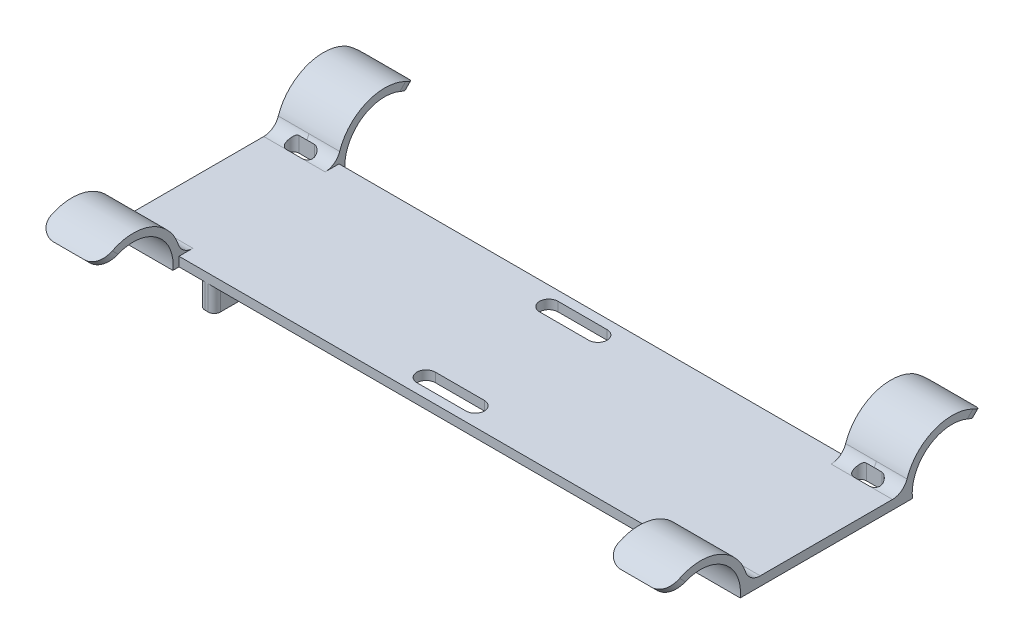
from build123d import *

# Parameters (mm, degrees)
BOSS_EXTRUDE2_DEPTH = 102.5
SKETCH5_W           = 165
SKETCH5_H           = 103.920310216
CUT_EXTRUDE1_DEPTH  = 116.767472629
CUT_EXTRUDE2_REACH  = 117.767
FILLET1_START       = -90.0000001
FILLET1_DEPTH       = 7.5000001
FILLET1_START_2     = 94.9999999
FILLET1_2_DEPTH     = 7.5000001
FILLET1_START_3     = -102.5
FILLET1_3_DEPTH     = 7.5
FILLET1_START_4     = 82.5
FILLET1_4_DEPTH     = 7.5
FILLET1_START_5     = -95.601637974
FILLET1_5_DEPTH     = 6.203275948
FILLET1_START_6     = 89.398362026
FILLET1_6_DEPTH     = 6.203275948
FILLET1_START_7     = 1.5
FILLET1_7_DEPTH     = 2.821223736
FILLET1_8_DEPTH     = 20
FILLET1_9_DEPTH     = 20
FILLET2_R           = 5
CUT_EXTRUDE3_REACH  = 117.767
SKETCH6_W           = 165
SKETCH6_H           = 2
SKETCH7_W           = 5
SKETCH7_H           = 52.17365686
BOSS_EXTRUDE3_DEPTH = 8
FILLET3_R           = 2


with BuildPart() as part:
    # Sketch2 → Boss-Extrude2 (new, symmetric)
    with BuildSketch(Plane(origin=(0, 0, 0), x_dir=(0, 0, -1), z_dir=(1, 0, 0))):
        with BuildLine():
            Line((-51.960155108, 10.960155108), (-50.192388155, 9.192388155))
            ThreePointArc((-50.192388155, 9.192388155), (-36.727498837, 12.277855424), (-28.08682843, 1.5))
            Line((-28.08682843, 1.5), (-25.572751379, 1.5))
            ThreePointArc((-25.572751379, 1.5), (-35.769095224, 14.590669458), (-51.960155108, 10.960155108))
        make_face()
        with BuildLine():
            Line((-25.572751379, 1.5), (-28.08682843, 1.5))
            ThreePointArc((-28.08682843, 1.5), (-28.021725261, 0.751255479), (-28, 0))
            ThreePointArc((-28, 0), (-28.021725261, -0.751255479), (-28.08682843, -1.5))
            Line((-28.08682843, -1.5), (-25.572751379, -1.5))
            ThreePointArc((-25.572751379, -1.5), (-25.518198528, -0.750881609), (-25.5, 0))
            ThreePointArc((-25.5, 0), (-25.518198528, 0.750881609), (-25.572751379, 1.5))
        make_face()
        with BuildLine():
            Line((25.572751379, 1.5), (-25.572751379, 1.5))
            ThreePointArc((-25.572751379, 1.5), (-25.518198528, 0.750881609), (-25.5, 0))
            ThreePointArc((-25.5, 0), (-25.518198528, -0.750881609), (-25.572751379, -1.5))
            Line((-25.572751379, -1.5), (25.572751379, -1.5))
            ThreePointArc((25.572751379, -1.5), (25.5, 0), (25.572751379, 1.5))
        make_face()
        with BuildLine():
            Line((28.08682843, 1.5), (25.572751379, 1.5))
            ThreePointArc((25.572751379, 1.5), (25.5, 0), (25.572751379, -1.5))
            Line((25.572751379, -1.5), (28.08682843, -1.5))
            ThreePointArc((28.08682843, -1.5), (28, 0), (28.08682843, 1.5))
        make_face()
        with BuildLine():
            ThreePointArc((51.960155108, 10.960155108), (35.769095224, 14.590669458), (25.572751379, 1.5))
            Line((25.572751379, 1.5), (28.08682843, 1.5))
            ThreePointArc((28.08682843, 1.5), (36.727498837, 12.277855424), (50.192388155, 9.192388155))
            Line((50.192388155, 9.192388155), (51.960155108, 10.960155108))
        make_face()
    extrude(amount=BOSS_EXTRUDE2_DEPTH, both=True)

    # Sketch5 → Cut-Extrude1 (cut, through all)
    # profile 1 of 5: a face of its own
    with BuildSketch(Plane(origin=(0, 1.5, 0), x_dir=(1, 0, 0), z_dir=(0, 1, 0))):
        Rectangle(SKETCH5_W, SKETCH5_H)
        with BuildLine():
            Line((-8, 23), (8, 23))
            ThreePointArc((8, 23), (11, 20), (8, 17))
            Line((8, 17), (-8, 17))
            ThreePointArc((-8, 17), (-11, 20), (-8, 23))
        make_face(mode=Mode.SUBTRACT)
        with BuildLine():
            Line((-8, -23), (8, -23))
            ThreePointArc((8, -23), (11, -20), (8, -17))
            Line((8, -17), (-8, -17))
            ThreePointArc((-8, -17), (-11, -20), (-8, -23))
        make_face(mode=Mode.SUBTRACT)
    # profile 2 of 5: a face of its own
    with BuildSketch(Plane(origin=(0, 1.5, 0), x_dir=(1, 0, 0), z_dir=(0, 1, 0))):
        with BuildLine():
            Line((-95, 25.572751379), (-90, 25.572751379))
            ThreePointArc((-90, 25.572751379), (-88, 23.572751379), (-90, 21.572751379))
            Line((-90, 21.572751379), (-95, 21.572751379))
            ThreePointArc((-95, 21.572751379), (-97, 23.572751379), (-95, 25.572751379))
        make_face()
    # profile 3 of 5: a face of its own
    with BuildSketch(Plane(origin=(0, 1.5, 0), x_dir=(1, 0, 0), z_dir=(0, 1, 0))):
        with BuildLine():
            Line((-95, -25.572751379), (-90, -25.572751379))
            ThreePointArc((-90, -25.572751379), (-88, -23.572751379), (-90, -21.572751379))
            Line((-90, -21.572751379), (-95, -21.572751379))
            ThreePointArc((-95, -21.572751379), (-97, -23.572751379), (-95, -25.572751379))
        make_face()
    # profile 4 of 5: a face of its own
    with BuildSketch(Plane(origin=(0, 1.5, 0), x_dir=(1, 0, 0), z_dir=(0, 1, 0))):
        with BuildLine():
            Line((95, 25.572751379), (90, 25.572751379))
            ThreePointArc((90, 25.572751379), (88, 23.572751379), (90, 21.572751379))
            Line((90, 21.572751379), (95, 21.572751379))
            ThreePointArc((95, 21.572751379), (97, 23.572751379), (95, 25.572751379))
        make_face()
    # profile 5 of 5: a face of its own
    with BuildSketch(Plane(origin=(0, 1.5, 0), x_dir=(1, 0, 0), z_dir=(0, 1, 0))):
        with BuildLine():
            Line((95, -25.572751379), (90, -25.572751379))
            ThreePointArc((90, -25.572751379), (88, -23.572751379), (90, -21.572751379))
            Line((90, -21.572751379), (95, -21.572751379))
            ThreePointArc((95, -21.572751379), (97, -23.572751379), (95, -25.572751379))
        make_face()
    extrude(amount=CUT_EXTRUDE1_DEPTH, mode=Mode.SUBTRACT)

    # Sketch5<3> → Cut-Extrude2 (cut, up to next)
    with BuildSketch(Plane(origin=(0, 1.5, 0), x_dir=(1, 0, 0), z_dir=(0, 1, 0)), mode=Mode.PRIVATE) as cut_extrude2_sk1:
        with BuildLine():
            Line((-95, 25.572751379), (-90, 25.572751379))
            ThreePointArc((-90, 25.572751379), (-88, 23.572751379), (-90, 21.572751379))
            Line((-90, 21.572751379), (-95, 21.572751379))
            ThreePointArc((-95, 21.572751379), (-97, 23.572751379), (-95, 25.572751379))
        make_face()
    cut_extrude2_tool1 = extrude(cut_extrude2_sk1.sketch, amount=-CUT_EXTRUDE2_REACH, mode=Mode.PRIVATE) & part.part
    # Sketch5<3> → Cut-Extrude2 (cut, up to next)
    with BuildSketch(Plane(origin=(0, 1.5, 0), x_dir=(1, 0, 0), z_dir=(0, 1, 0)), mode=Mode.PRIVATE) as cut_extrude2_sk2:
        with BuildLine():
            Line((-95, -25.572751379), (-90, -25.572751379))
            ThreePointArc((-90, -25.572751379), (-88, -23.572751379), (-90, -21.572751379))
            Line((-90, -21.572751379), (-95, -21.572751379))
            ThreePointArc((-95, -21.572751379), (-97, -23.572751379), (-95, -25.572751379))
        make_face()
    cut_extrude2_tool2 = extrude(cut_extrude2_sk2.sketch, amount=-CUT_EXTRUDE2_REACH, mode=Mode.PRIVATE) & part.part
    # Sketch5<3> → Cut-Extrude2 (cut, up to next)
    with BuildSketch(Plane(origin=(0, 1.5, 0), x_dir=(1, 0, 0), z_dir=(0, 1, 0)), mode=Mode.PRIVATE) as cut_extrude2_sk3:
        with BuildLine():
            Line((95, 25.572751379), (90, 25.572751379))
            ThreePointArc((90, 25.572751379), (88, 23.572751379), (90, 21.572751379))
            Line((90, 21.572751379), (95, 21.572751379))
            ThreePointArc((95, 21.572751379), (97, 23.572751379), (95, 25.572751379))
        make_face()
    cut_extrude2_tool3 = extrude(cut_extrude2_sk3.sketch, amount=-CUT_EXTRUDE2_REACH, mode=Mode.PRIVATE) & part.part
    # Sketch5<3> → Cut-Extrude2 (cut, up to next)
    with BuildSketch(Plane(origin=(0, 1.5, 0), x_dir=(1, 0, 0), z_dir=(0, 1, 0)), mode=Mode.PRIVATE) as cut_extrude2_sk4:
        with BuildLine():
            Line((95, -25.572751379), (90, -25.572751379))
            ThreePointArc((90, -25.572751379), (88, -23.572751379), (90, -21.572751379))
            Line((90, -21.572751379), (95, -21.572751379))
            ThreePointArc((95, -21.572751379), (97, -23.572751379), (95, -25.572751379))
        make_face()
    cut_extrude2_tool4 = extrude(cut_extrude2_sk4.sketch, amount=-CUT_EXTRUDE2_REACH, mode=Mode.PRIVATE) & part.part
    # Sketch5<3> → Cut-Extrude2 (cut, up to next)
    with BuildSketch(Plane(origin=(0, 1.5, 0), x_dir=(1, 0, 0), z_dir=(0, 1, 0)), mode=Mode.PRIVATE) as cut_extrude2_sk5:
        with BuildLine():
            Line((-8, 23), (8, 23))
            ThreePointArc((8, 23), (11, 20), (8, 17))
            Line((8, 17), (-8, 17))
            ThreePointArc((-8, 17), (-11, 20), (-8, 23))
        make_face()
    cut_extrude2_tool5 = extrude(cut_extrude2_sk5.sketch, amount=-CUT_EXTRUDE2_REACH, mode=Mode.PRIVATE) & part.part
    # Sketch5<3> → Cut-Extrude2 (cut, up to next)
    with BuildSketch(Plane(origin=(0, 1.5, 0), x_dir=(1, 0, 0), z_dir=(0, 1, 0)), mode=Mode.PRIVATE) as cut_extrude2_sk6:
        with BuildLine():
            Line((-8, -23), (8, -23))
            ThreePointArc((8, -23), (11, -20), (8, -17))
            Line((8, -17), (-8, -17))
            ThreePointArc((-8, -17), (-11, -20), (-8, -23))
        make_face()
    cut_extrude2_tool6 = extrude(cut_extrude2_sk6.sketch, amount=-CUT_EXTRUDE2_REACH, mode=Mode.PRIVATE) & part.part
    add(cut_extrude2_tool1.solids().sort_by_distance((-92.5, 1.5, -23.572751))[0], mode=Mode.SUBTRACT)
    add(cut_extrude2_tool2.solids().sort_by_distance((-92.5, 1.5, 23.572751))[0], mode=Mode.SUBTRACT)
    add(cut_extrude2_tool3.solids().sort_by_distance((92.5, 1.5, -23.572751))[0], mode=Mode.SUBTRACT)
    add(cut_extrude2_tool4.solids().sort_by_distance((92.5, 1.5, 23.572751))[0], mode=Mode.SUBTRACT)
    add(cut_extrude2_tool5.solids().sort_by_distance((0, 1.5, -20))[0], mode=Mode.SUBTRACT)
    add(cut_extrude2_tool6.solids().sort_by_distance((0, 1.5, 20))[0], mode=Mode.SUBTRACT)

    # Fillet1: read off the stored shape, not the designer's step
    # Fillet1 outline → Fillet1 (add)
    with BuildSketch(Plane.YZ.offset(FILLET1_START)):
        with BuildLine():
            Line((1.5, 25.572751379), (1.5, 21.557777905))
            ThreePointArc((1.5, 21.557777905), (2.442486644, 24.479521454), (4.914634146, 26.299783294))
            ThreePointArc((4.914634146, 26.299783294), (3.22785171, 25.83982278), (1.5, 25.572751379))
        make_face()
        with BuildLine():
            ThreePointArc((3.520069129, -25.57275138), (2.033477059, -23.805036862), (1.5, -21.557777905))
            Line((1.5, -21.557777905), (1.5, -25.572751379))
            Line((1.5, -25.572751379), (3.520069129, -25.57275138))
        make_face()
    extrude(amount=FILLET1_DEPTH)

    # Fillet1 2 outline → Fillet1 2 (add)
    with BuildSketch(Plane.YZ.offset(FILLET1_START_2)):
        with BuildLine():
            Line((1.5, 25.572751379), (1.5, 21.557777905))
            ThreePointArc((1.5, 21.557777905), (2.442486644, 24.479521454), (4.914634146, 26.299783294))
            ThreePointArc((4.914634146, 26.299783294), (3.22785171, 25.83982278), (1.5, 25.572751379))
        make_face()
        with BuildLine():
            ThreePointArc((3.520069129, -25.57275138), (2.033477059, -23.805036862), (1.5, -21.557777905))
            Line((1.5, -21.557777905), (1.5, -25.572751379))
            Line((1.5, -25.572751379), (3.520069129, -25.57275138))
        make_face()
    extrude(amount=FILLET1_2_DEPTH)

    # Fillet1 3 outline → Fillet1 3 (add)
    with BuildSketch(Plane.YZ.offset(FILLET1_START_3)):
        with BuildLine():
            Line((1.5, 25.572751379), (1.5, 21.557777905))
            ThreePointArc((1.5, 21.557777905), (2.442486644, 24.479521454), (4.914634146, 26.299783294))
            ThreePointArc((4.914634146, 26.299783294), (3.22785171, 25.83982278), (1.5, 25.572751379))
        make_face()
        with BuildLine():
            ThreePointArc((3.520069129, -25.57275138), (2.033477059, -23.805036862), (1.5, -21.557777905))
            Line((1.5, -21.557777905), (1.5, -25.572751379))
            Line((1.5, -25.572751379), (3.520069129, -25.57275138))
        make_face()
    extrude(amount=FILLET1_3_DEPTH)

    # Fillet1 4 outline → Fillet1 4 (add)
    with BuildSketch(Plane.YZ.offset(FILLET1_START_4)):
        with BuildLine():
            Line((1.5, 25.572751379), (1.5, 21.557777905))
            ThreePointArc((1.5, 21.557777905), (2.442486644, 24.479521454), (4.914634146, 26.299783294))
            ThreePointArc((4.914634146, 26.299783294), (3.22785171, 25.83982278), (1.5, 25.572751379))
        make_face()
        with BuildLine():
            ThreePointArc((3.520069129, -25.57275138), (2.033477059, -23.805036862), (1.5, -21.557777905))
            Line((1.5, -21.557777905), (1.5, -25.572751379))
            Line((1.5, -25.572751379), (3.520069129, -25.57275138))
        make_face()
    extrude(amount=FILLET1_4_DEPTH)

    # Fillet1 5 outline → Fillet1 5 (add)
    with BuildSketch(Plane.YZ.offset(FILLET1_START_5)):
        with BuildLine():
            Line((1.5, 25.572751379), (3.520069129, 25.57275138))
            ThreePointArc((3.520069129, 25.57275138), (4.188587575, 25.991441469), (4.914634146, 26.299783294))
            ThreePointArc((4.914634146, 26.299783294), (3.22785171, 25.83982278), (1.5, 25.572751379))
        make_face()
    extrude(amount=FILLET1_5_DEPTH)

    # Fillet1 6 outline → Fillet1 6 (add)
    with BuildSketch(Plane.YZ.offset(FILLET1_START_6)):
        with BuildLine():
            Line((1.5, 25.572751379), (3.520069129, 25.57275138))
            ThreePointArc((3.520069129, 25.57275138), (4.188587575, 25.991441469), (4.914634146, 26.299783294))
            ThreePointArc((4.914634146, 26.299783294), (3.22785171, 25.83982278), (1.5, 25.572751379))
        make_face()
    extrude(amount=FILLET1_6_DEPTH)

    # Fillet1 7 outline → Fillet1 7 (cut)
    with BuildSketch(Plane(origin=(0, 0, 0), x_dir=(1, 0, 0), z_dir=(0, 1, 0)).offset(FILLET1_START_7)):
        with BuildLine():
            Line((95, -21.572751379), (95, -25.572751379))
            ThreePointArc((95, -25.572751379), (97, -23.572751379), (95, -21.572751379))
        make_face()
        with BuildLine():
            Line((90, -25.572751379), (90, -21.572751379))
            ThreePointArc((90, -21.572751379), (88, -23.572751379), (90, -25.572751379))
        make_face()
        with BuildLine():
            Line((90, 21.572751379), (90, 25.572751379))
            ThreePointArc((90, 25.572751379), (88, 23.572751379), (90, 21.572751379))
        make_face()
        with BuildLine():
            ThreePointArc((95, 21.572751379), (97, 23.572751379), (95, 25.572751379))
            Line((95, 25.572751379), (95, 21.572751379))
        make_face()
        with BuildLine():
            ThreePointArc((-90, 21.572751379), (-88, 23.572751379), (-90, 25.572751379))
            Line((-90, 25.572751379), (-90, 21.572751379))
        make_face()
        with BuildLine():
            Line((-95, 21.572751379), (-95, 25.572751379))
            ThreePointArc((-95, 25.572751379), (-97, 23.572751379), (-95, 21.572751379))
        make_face()
        with BuildLine():
            Line((-90, -21.572751379), (-90, -25.572751379))
            ThreePointArc((-90, -25.572751379), (-88, -23.572751379), (-90, -21.572751379))
        make_face()
        with BuildLine():
            Line((-95, -25.572751379), (-95, -21.572751379))
            ThreePointArc((-95, -21.572751379), (-97, -23.572751379), (-95, -25.572751379))
        make_face()
    extrude(amount=FILLET1_7_DEPTH, mode=Mode.SUBTRACT)

    # Fillet1 8 outline → Fillet1 8 (add)
    with BuildSketch(Plane.YZ.offset(FILLET1_START_3)):
        with BuildLine():
            ThreePointArc((1.5, -25.572751379), (3.22785171, -25.83982278), (4.914634146, -26.299783293))
            ThreePointArc((4.914634146, -26.299783293), (4.188587575, -25.991441469), (3.520069129, -25.57275138))
            Line((3.520069129, -25.57275138), (1.5, -25.572751379))
        make_face()
    extrude(amount=FILLET1_8_DEPTH)

    # Fillet1 9 outline → Fillet1 9 (add)
    with BuildSketch(Plane.YZ.offset(FILLET1_START_4)):
        with BuildLine():
            ThreePointArc((1.5, -25.572751379), (3.22785171, -25.83982278), (4.914634146, -26.299783293))
            ThreePointArc((4.914634146, -26.299783293), (4.188587575, -25.991441469), (3.520069129, -25.57275138))
            Line((3.520069129, -25.57275138), (1.5, -25.572751379))
        make_face()
    extrude(amount=FILLET1_9_DEPTH)

    # Fillet2
    fillet2_edges = [part.edges().sort_by_distance(p)[0] for p in [
        (-102.5, 10.076271632, 51.076271632),
        (-102.5, 10.076271632, -51.076271632),
        (102.5, 10.076271632, -51.076271632),
        (-82.5, 10.076271632, 51.076271632),
        (82.5, 10.076271632, 51.076271632),
        (102.5, 10.076271632, 51.076271632),
        (82.5, 10.076271632, -51.076271632),
        (-82.5, 10.076271632, -51.076271632),
    ]]
    fillet(fillet2_edges, radius=FILLET2_R)

    # Sketch6 → Cut-Extrude3 (cut, up to next)
    with BuildSketch(Plane(origin=(0, 1.5, 0), x_dir=(1, 0, 0), z_dir=(0, 1, 0)), mode=Mode.PRIVATE) as cut_extrude3_sk1:
        with Locations((0, 27.08682843)):
            Rectangle(SKETCH6_W, SKETCH6_H)
    cut_extrude3_tool1 = extrude(cut_extrude3_sk1.sketch, amount=-CUT_EXTRUDE3_REACH, mode=Mode.PRIVATE) & part.part
    # Sketch6 → Cut-Extrude3 (cut, up to next)
    with BuildSketch(Plane(origin=(0, 1.5, 0), x_dir=(1, 0, 0), z_dir=(0, 1, 0)), mode=Mode.PRIVATE) as cut_extrude3_sk2:
        with Locations((0, -27.08682843)):
            Rectangle(SKETCH6_W, SKETCH6_H)
    cut_extrude3_tool2 = extrude(cut_extrude3_sk2.sketch, amount=-CUT_EXTRUDE3_REACH, mode=Mode.PRIVATE) & part.part
    add(cut_extrude3_tool1.solids().sort_by_distance((0, 1.5, -27.086828))[0], mode=Mode.SUBTRACT)
    add(cut_extrude3_tool2.solids().sort_by_distance((0, 1.5, 27.086828))[0], mode=Mode.SUBTRACT)

    # Sketch7 → Boss-Extrude3 (add)
    with BuildSketch(Plane(origin=(0, -1.5, 0), x_dir=(-1, 0, 0), z_dir=(0, -1, 0))):
        with Locations((-73.5, 0)):
            Rectangle(SKETCH7_W, SKETCH7_H)
        with Locations((73.5, 0)):
            Rectangle(SKETCH7_W, SKETCH7_H)
    extrude(amount=BOSS_EXTRUDE3_DEPTH)

    # Fillet3
    fillet3_edges = [part.edges().sort_by_distance(p)[0] for p in [
        (71, -5.5, -26.08682843),
        (76, -5.5, -26.08682843),
        (76, -5.5, 26.08682843),
        (71, -5.5, 26.08682843),
        (-76, -5.5, 26.08682843),
        (-76, -5.5, -26.08682843),
        (-71, -5.5, -26.08682843),
        (-71, -5.5, 26.08682843),
    ]]
    fillet(fillet3_edges, radius=FILLET3_R)


solid = part.part
